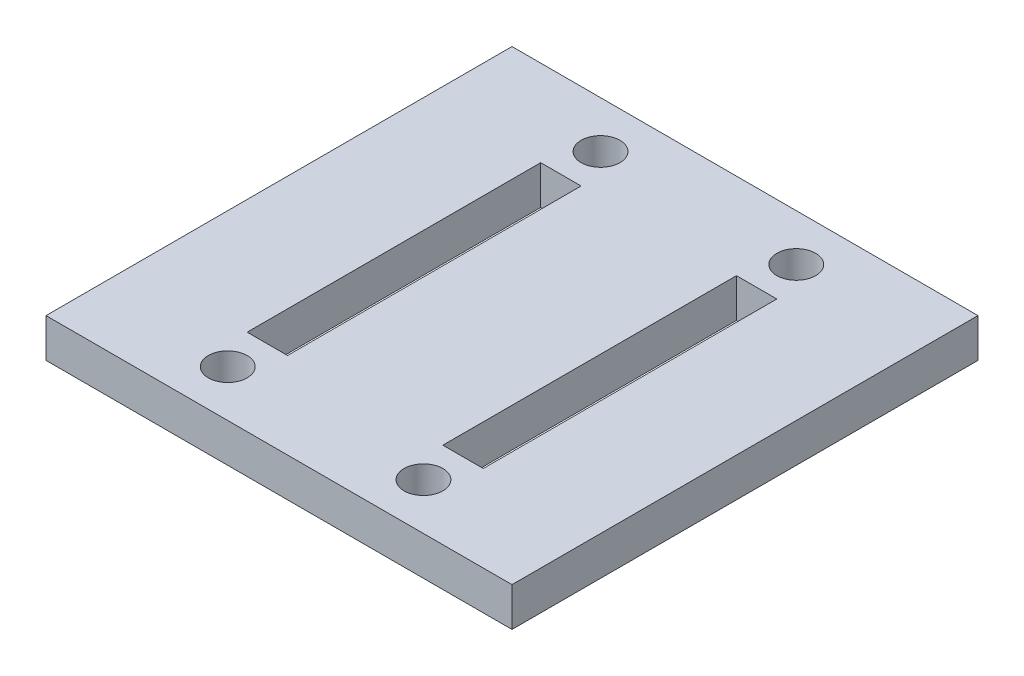
from build123d import *

# Parameters (mm, degrees)
SKETCH1_W           = 76.2
SKETCH1_H           = 76.2
BOSS_EXTRUDE1_DEPTH = 6.35
SKETCH2_W           = 6.604
SKETCH2_H           = 48.006
CUT_EXTRUDE1_DEPTH  = 55.254423783
SKETCH3_R           = 3.175
CUT_EXTRUDE3_DEPTH  = 55.254423783


with BuildPart() as part:
    # Sketch1 → Boss-Extrude1 (new body)
    with BuildSketch(Plane(origin=(0, 0, 0), x_dir=(1, 0, 0), z_dir=(0, 1, 0))):
        Rectangle(SKETCH1_W, SKETCH1_H)
    extrude(amount=BOSS_EXTRUDE1_DEPTH)

    # Sketch2 → Cut-Extrude1 (cut, through all)
    with BuildSketch(Plane(origin=(0, 0, 0), x_dir=(1, 0, 0), z_dir=(0, 1, 0))):
        with Locations((16.002, 0)):
            Rectangle(SKETCH2_W, SKETCH2_H)
        with Locations((-16.002, 0)):
            Rectangle(SKETCH2_W, SKETCH2_H)
    extrude(amount=CUT_EXTRUDE1_DEPTH, mode=Mode.SUBTRACT)

    # Sketch3 → Cut-Extrude3 (cut, through all)
    with BuildSketch(Plane(origin=(0, 0, 0), x_dir=(1, 0, 0), z_dir=(0, 1, 0))):
        with Locations((-16.002, 30.48)):
            Circle(SKETCH3_R)
        with Locations((-16.002, -30.48)):
            Circle(SKETCH3_R)
        with Locations((16.002, -30.48)):
            Circle(SKETCH3_R)
        with Locations((16.002, 30.48)):
            Circle(SKETCH3_R)
    extrude(amount=CUT_EXTRUDE3_DEPTH, mode=Mode.SUBTRACT)


solid = part.part
